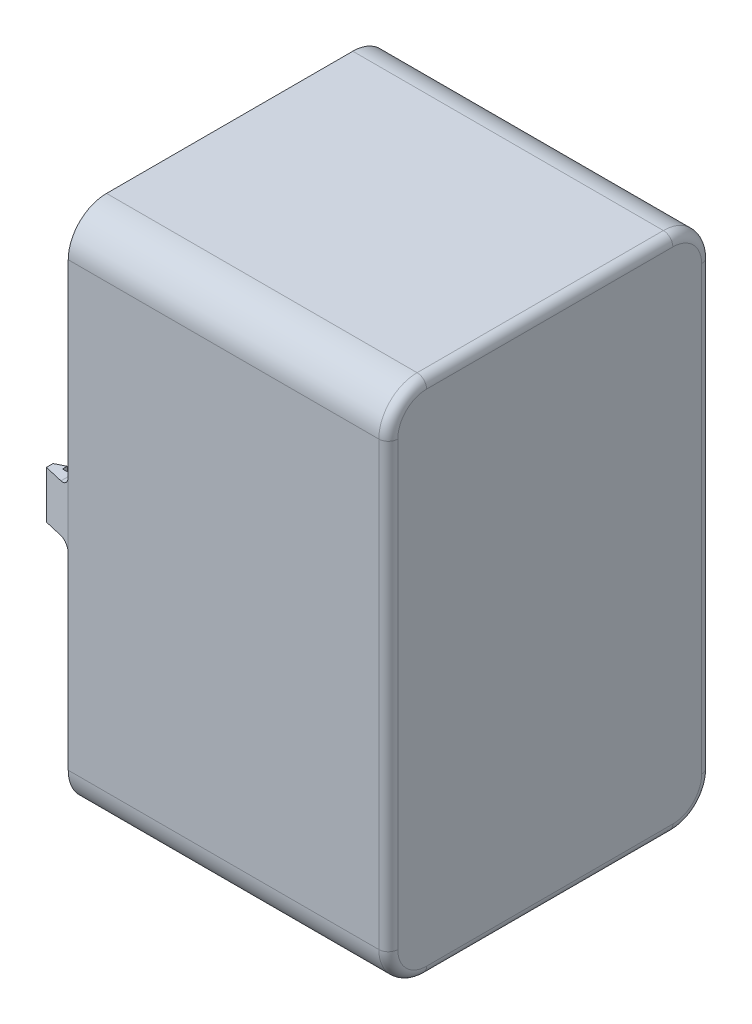
from build123d import *

# Parameters (mm, degrees)
BOSS_EXTRUDE2_DEPTH      = 13
BOSS_EXTRUDE2_DEPTH_BACK = 19.75
SKETCH2_W                = 39
SKETCH2_H                = 12
BOSS_EXTRUDE3_DEPTH      = 1
CUT_EXTRUDE1_DEPTH       = 19.727
CLIP_EDGE_DEPTH          = 2.5
FILLET1_R                = 1


with BuildPart() as part:
    # Sketch2 → Boss-Extrude2 (new, two sides: drawn at the far end of the back side and taken through both)
    with BuildSketch(Plane(origin=(0, 0, 0), x_dir=(0, -1, 0), z_dir=(1, 0, 0)).offset(-BOSS_EXTRUDE2_DEPTH_BACK)):
        with BuildLine():
            Line((-1027.172700071, 1376.290334899), (-1027.172700071, 1350.320334899))
            ThreePointArc((-1027.172700071, 1350.320334899), (-1025.989411467, 1347.463623503), (-1023.132700071, 1346.280334899))
            Line((-1023.132700071, 1346.280334899), (-976.512700071, 1346.280334899))
            ThreePointArc((-976.512700071, 1346.280334899), (-973.655988675, 1347.463623503), (-972.472700071, 1350.320334899))
            Line((-972.472700071, 1350.320334899), (-972.472700071, 1376.290334899))
            ThreePointArc((-972.472700071, 1376.290334899), (-973.655988675, 1379.147046295), (-976.512700071, 1380.330334899))
            Line((-976.512700071, 1380.330334899), (-1023.132700071, 1380.330334899))
            ThreePointArc((-1023.132700071, 1380.330334899), (-1025.989411467, 1379.147046295), (-1027.172700071, 1376.290334899))
        make_face()
        with Locations((-999.822700071, 1363.305334899)):
            Rectangle(SKETCH2_W, SKETCH2_H, mode=Mode.SUBTRACT)
    extrude(amount=BOSS_EXTRUDE2_DEPTH + BOSS_EXTRUDE2_DEPTH_BACK)

    # Sketch3 → Boss-Extrude3 (add)
    with BuildSketch(Plane.YZ.offset(13)):
        with BuildLine():
            Line((972.472700071, -1350.320334899), (972.472700071, -1376.290334899))
            ThreePointArc((972.472700071, -1376.290334899), (973.655988675, -1379.147046295), (976.512700071, -1380.330334899))
            Line((976.512700071, -1380.330334899), (1023.132700071, -1380.330334899))
            ThreePointArc((1023.132700071, -1380.330334899), (1025.989411467, -1379.147046295), (1027.172700071, -1376.290334899))
            Line((1027.172700071, -1376.290334899), (1027.172700071, -1350.320334899))
            ThreePointArc((1027.172700071, -1350.320334899), (1025.989411467, -1347.463623503), (1023.132700071, -1346.280334899))
            Line((1023.132700071, -1346.280334899), (976.512700071, -1346.280334899))
            ThreePointArc((976.512700071, -1346.280334899), (973.655988675, -1347.463623503), (972.472700071, -1350.320334899))
        make_face()
    extrude(amount=BOSS_EXTRUDE3_DEPTH)

    # Sketch6 → Cut-Extrude1 (cut)
    with BuildSketch(Plane(origin=(-19.75, 0, 0), x_dir=(0, -1, 0), z_dir=(-1, 0, 0))):
        with BuildLine():
            Line((-1025.772700071, -1350.320334899), (-1025.772700071, -1376.290334899))
            ThreePointArc((-1025.772700071, -1376.290334899), (-1024.999461974, -1378.157096801), (-1023.132700071, -1378.930334899))
            Line((-1023.132700071, -1378.930334899), (-976.512700071, -1378.930334899))
            ThreePointArc((-976.512700071, -1378.930334899), (-974.645938169, -1378.157096801), (-973.872700071, -1376.290334899))
            Line((-973.872700071, -1376.290334899), (-973.872700071, -1350.320334899))
            ThreePointArc((-973.872700071, -1350.320334899), (-974.645938169, -1348.453572996), (-976.512700071, -1347.680334899))
            Line((-976.512700071, -1347.680334899), (-1023.132700071, -1347.680334899))
            ThreePointArc((-1023.132700071, -1347.680334899), (-1024.999461974, -1348.453572996), (-1025.772700071, -1350.320334899))
        make_face()
    extrude(amount=-CUT_EXTRUDE1_DEPTH, mode=Mode.SUBTRACT)

    # Sketch10 → Clip Edge (add, symmetric)
    with BuildSketch(Plane(origin=(0, 999.822700071, 0), x_dir=(-1, 0, 0), z_dir=(0, -1, 0))):
        Polygon((19.75, 1346.280334899), (19.75, 1347.680334899), (21.75, 1347.680334899), (21.75, 1348.180334899), (22.75, 1347.680334899), (22.75, 1346.980334899), align=None)
    clip_edge = extrude(amount=CLIP_EDGE_DEPTH, both=True)

    # Mirror1: Clip Edge across plane
    add(clip_edge.mirror(Plane(origin=(0, 0, -1363.305334899), x_dir=(1, 0, 0), z_dir=(0, 0, -1))))

    # Fillet1
    # the kernel refuses this fillet: 1 mm, written as the material it adds along each edge
    with BuildSketch(Plane(origin=(-19.75, 1002.322700071, -1346.280334899), x_dir=(0, 1, 0), z_dir=(0, 0, -1))) as fillet1_piece_1_section:
        with BuildLine():
            CenterArc((FILLET1_R, -FILLET1_R), FILLET1_R, 90, 90)
            Line((0, -FILLET1_R), (0, 0))
            Line((0, 0), (FILLET1_R, 0))
        make_face()
    fillet1_piece_1 = extrude(amount=1.4, mode=Mode.PRIVATE)
    fillet1_piece_1 = split(fillet1_piece_1, bisect_by=Plane(origin=(-20.117660962, 1002.553814872, -1346.366122456), z_dir=(0.22722961560622243, 0, -0.973841209741839)), keep=Keep.TOP, mode=Mode.PRIVATE)
    add(fillet1_piece_1)
    with BuildSketch(Plane(origin=(-19.75, 997.322700071, -1346.280334899), x_dir=(0, -1, 0), z_dir=(0, 0, -1))) as fillet1_piece_2_section:
        with BuildLine():
            CenterArc((FILLET1_R, FILLET1_R), FILLET1_R, 180, 90)
            Line((0, FILLET1_R), (0, 0))
            Line((0, 0), (FILLET1_R, 0))
        make_face()
    fillet1_piece_2 = extrude(amount=1.4, mode=Mode.PRIVATE)
    fillet1_piece_2 = split(fillet1_piece_2, bisect_by=Plane(origin=(-20.117660962, 997.091585271, -1346.366122456), z_dir=(0.22722961560622243, 0, -0.973841209741839)), keep=Keep.TOP, mode=Mode.PRIVATE)
    add(fillet1_piece_2)
    with BuildSketch(Plane(origin=(-19.75, 997.322700071, -1380.330334899), x_dir=(0, -1, 0), z_dir=(0, 0, 1))) as fillet1_piece_3_section:
        with BuildLine():
            CenterArc((FILLET1_R, -FILLET1_R), FILLET1_R, 90, 90)
            Line((0, -FILLET1_R), (0, 0))
            Line((0, 0), (FILLET1_R, 0))
        make_face()
    fillet1_piece_3 = extrude(amount=1.4, mode=Mode.PRIVATE)
    fillet1_piece_3 = split(fillet1_piece_3, bisect_by=Plane(origin=(-20.117660962, 997.091585271, -1380.244547341), z_dir=(0.22722961560622243, 0, 0.973841209741839)), keep=Keep.TOP, mode=Mode.PRIVATE)
    add(fillet1_piece_3)
    with BuildSketch(Plane(origin=(-19.75, 1002.322700071, -1380.330334899), x_dir=(0, 1, 0), z_dir=(0, 0, 1))) as fillet1_piece_4_section:
        with BuildLine():
            CenterArc((FILLET1_R, FILLET1_R), FILLET1_R, 180, 90)
            Line((0, FILLET1_R), (0, 0))
            Line((0, 0), (FILLET1_R, 0))
        make_face()
    fillet1_piece_4 = extrude(amount=1.4, mode=Mode.PRIVATE)
    fillet1_piece_4 = split(fillet1_piece_4, bisect_by=Plane(origin=(-20.117660962, 1002.553814872, -1380.244547341), z_dir=(0.22722961560622243, 0, 0.973841209741839)), keep=Keep.TOP, mode=Mode.PRIVATE)
    add(fillet1_piece_4)
    with BuildSketch(Plane(origin=(13, 1021.822700071, -1369.305334899), x_dir=(-1, 0, 0), z_dir=(0, -1, 0)), Plane(origin=(13, 977.822700071, -1357.305334899), x_dir=(-1, 0, 0), z_dir=(0, 1, 0))) as fillet1_piece_5:
        with BuildLine():
            CenterArc((FILLET1_R, -FILLET1_R), FILLET1_R, 90, 90)
            Line((0, -FILLET1_R), (0, 0))
            Line((0, 0), (FILLET1_R, 0))
        make_face()
    extrude(amount=44)
    with BuildSketch(Plane(origin=(13, 1019.322700071, -1354.805334899), x_dir=(-1, 0, 0), z_dir=(0, 0, -1)), Plane(origin=(13, 980.322700071, -1371.805334899), x_dir=(-1, 0, 0), z_dir=(0, 0, 1))) as fillet1_piece_6:
        with BuildLine():
            CenterArc((FILLET1_R, -FILLET1_R), FILLET1_R, 90, 90)
            Line((0, -FILLET1_R), (0, 0))
            Line((0, 0), (FILLET1_R, 0))
        make_face()
    extrude(amount=17)
    # the kernel refuses this fillet: 1 mm, written as the material it takes off along each edge
    with BuildSketch(Plane(origin=(14, 976.512700071, -1350.320334899), x_dir=(0, 0, 1), z_dir=(0, 1, 0))) as fillet1_2_piece_1:
        with BuildLine():
            CenterArc((4.04 - FILLET1_R, -FILLET1_R), FILLET1_R, 0, 90)
            Line((4.04 - FILLET1_R, 0), (4.04, 0))
            Line((4.04, 0), (4.04, -FILLET1_R))
        make_face()
    revolve(axis=Axis((14, 976.512700071, -1350.320334899), (1, 0, 0)), revolution_arc=90, mode=Mode.SUBTRACT)
    with BuildSketch(Plane(origin=(14, 972.472700071, -1350.320334899), x_dir=(-1, 0, 0), z_dir=(0, 0, -1)), Plane(origin=(14, 1027.172700071, -1376.290334899), x_dir=(-1, 0, 0), z_dir=(0, 0, 1))) as fillet1_2_piece_2:
        with BuildLine():
            CenterArc((FILLET1_R, FILLET1_R), FILLET1_R, 180, 90)
            Line((0, FILLET1_R), (0, 0))
            Line((0, 0), (FILLET1_R, 0))
        make_face()
    extrude(amount=25.97, mode=Mode.SUBTRACT)
    with BuildSketch(Plane(origin=(14, 976.512700071, -1376.290334899), x_dir=(0, -1, 0), z_dir=(0, 0, 1))) as fillet1_2_piece_3:
        with BuildLine():
            CenterArc((4.04 - FILLET1_R, -FILLET1_R), FILLET1_R, 0, 90)
            Line((4.04 - FILLET1_R, 0), (4.04, 0))
            Line((4.04, 0), (4.04, -FILLET1_R))
        make_face()
    revolve(axis=Axis((14, 976.512700071, -1376.290334899), (1, 0, 0)), revolution_arc=90, mode=Mode.SUBTRACT)
    with BuildSketch(Plane(origin=(14, 976.512700071, -1380.330334899), x_dir=(-1, 0, 0), z_dir=(0, 1, 0)), Plane(origin=(14, 1023.132700071, -1346.280334899), x_dir=(-1, 0, 0), z_dir=(0, -1, 0))) as fillet1_2_piece_4:
        with BuildLine():
            CenterArc((FILLET1_R, FILLET1_R), FILLET1_R, 180, 90)
            Line((0, FILLET1_R), (0, 0))
            Line((0, 0), (FILLET1_R, 0))
        make_face()
    extrude(amount=46.62, mode=Mode.SUBTRACT)
    with BuildSketch(Plane(origin=(14, 1023.132700071, -1376.290334899), x_dir=(0, 0, -1), z_dir=(0, -1, 0))) as fillet1_2_piece_5:
        with BuildLine():
            CenterArc((4.04 - FILLET1_R, -FILLET1_R), FILLET1_R, 0, 90)
            Line((4.04, -FILLET1_R), (4.04, 0))
            Line((4.04, 0), (4.04 - FILLET1_R, 0))
        make_face()
    revolve(axis=Axis((14, 1023.132700071, -1376.290334899), (1, 0, 0)), revolution_arc=90, mode=Mode.SUBTRACT)
    with BuildSketch(Plane(origin=(14, 1023.132700071, -1350.320334899), x_dir=(0, 1, 0), z_dir=(0, 0, -1))) as fillet1_2_piece_6:
        with BuildLine():
            CenterArc((4.04 - FILLET1_R, -FILLET1_R), FILLET1_R, 0, 90)
            Line((4.04 - FILLET1_R, 0), (4.04, 0))
            Line((4.04, 0), (4.04, -FILLET1_R))
        make_face()
    revolve(axis=Axis((14, 1023.132700071, -1350.320334899), (1, 0, 0)), revolution_arc=90, mode=Mode.SUBTRACT)
    with BuildSketch(Plane(origin=(-0.023, 1019.322700071, -1369.305334899), x_dir=(0, 1, 0), z_dir=(0, 0, 1)), Plane(origin=(-0.023, 980.322700071, -1357.305334899), x_dir=(0, -1, 0), z_dir=(0, 0, -1))) as fillet1_2_piece_7:
        with BuildLine():
            CenterArc((FILLET1_R, -FILLET1_R), FILLET1_R, 90, 90)
            Line((0, -FILLET1_R), (0, 0))
            Line((0, 0), (FILLET1_R, 0))
        make_face()
    extrude(amount=12, mode=Mode.SUBTRACT)
    with BuildSketch(Plane(origin=(-0.023, 980.322700071, -1369.305334899), x_dir=(0, 0, -1), z_dir=(0, 1, 0)), Plane(origin=(-0.023, 1019.322700071, -1357.305334899), x_dir=(0, 0, 1), z_dir=(0, -1, 0))) as fillet1_2_piece_8:
        with BuildLine():
            CenterArc((FILLET1_R, -FILLET1_R), FILLET1_R, 90, 90)
            Line((0, -FILLET1_R), (0, 0))
            Line((0, 0), (FILLET1_R, 0))
        make_face()
    extrude(amount=39, mode=Mode.SUBTRACT)
    with BuildSketch(Plane(origin=(-0.023, 1019.322700071, -1371.805334899), x_dir=(0, 1, 0), z_dir=(0, 0, 1))) as fillet1_2_piece_9a_section:
        with BuildLine():
            CenterArc((FILLET1_R, -FILLET1_R), FILLET1_R, 90, 90)
            Line((0, -FILLET1_R), (0, 0))
            Line((0, 0), (FILLET1_R, 0))
        make_face()
    fillet1_2_piece_9a = extrude(amount=14.5, mode=Mode.PRIVATE)
    fillet1_2_piece_9a = split(fillet1_2_piece_9a, bisect_by=Plane(origin=(0.203395114, 1019.549095185, -1369.305334899), z_dir=(0, 0, -1)), keep=Keep.TOP, mode=Mode.PRIVATE)
    with BuildSketch(Plane(origin=(-0.023, 980.322700071, -1369.305334899), x_dir=(0, 0, -1), z_dir=(0, 1, 0))) as fillet1_2_piece_9b_section:
        with BuildLine():
            CenterArc((FILLET1_R, -FILLET1_R), FILLET1_R, 90, 90)
            Line((0, -FILLET1_R), (0, 0))
            Line((0, 0), (FILLET1_R, 0))
        make_face()
    fillet1_2_piece_9b = extrude(amount=41.5, mode=Mode.PRIVATE)
    fillet1_2_piece_9b = split(fillet1_2_piece_9b, bisect_by=Plane(origin=(0.203395114, 1019.322700071, -1369.531730013), z_dir=(0, 1, 0)), keep=Keep.TOP, mode=Mode.PRIVATE)
    fillet1_2_piece_9 = fillet1_2_piece_9a & fillet1_2_piece_9b
    add(fillet1_2_piece_9, mode=Mode.SUBTRACT)
    with BuildSketch(Plane(origin=(-0.023, 1021.822700071, -1357.305334899), x_dir=(0, 0, 1), z_dir=(0, -1, 0))) as fillet1_2_piece_10a_section:
        with BuildLine():
            CenterArc((FILLET1_R, -FILLET1_R), FILLET1_R, 90, 90)
            Line((0, -FILLET1_R), (0, 0))
            Line((0, 0), (FILLET1_R, 0))
        make_face()
    fillet1_2_piece_10a = extrude(amount=41.5, mode=Mode.PRIVATE)
    fillet1_2_piece_10a = split(fillet1_2_piece_10a, bisect_by=Plane(origin=(0.203395114, 1019.322700071, -1357.078939784), z_dir=(0, 1, 0)), keep=Keep.TOP, mode=Mode.PRIVATE)
    with BuildSketch(Plane(origin=(-0.023, 1019.322700071, -1369.305334899), x_dir=(0, 1, 0), z_dir=(0, 0, 1))) as fillet1_2_piece_10b_section:
        with BuildLine():
            CenterArc((FILLET1_R, -FILLET1_R), FILLET1_R, 90, 90)
            Line((0, -FILLET1_R), (0, 0))
            Line((0, 0), (FILLET1_R, 0))
        make_face()
    fillet1_2_piece_10b = extrude(amount=14.5, mode=Mode.PRIVATE)
    fillet1_2_piece_10b = split(fillet1_2_piece_10b, bisect_by=Plane(origin=(0.203395114, 1019.549095185, -1357.305334899), z_dir=(0, 0, 1)), keep=Keep.TOP, mode=Mode.PRIVATE)
    fillet1_2_piece_10 = fillet1_2_piece_10a & fillet1_2_piece_10b
    add(fillet1_2_piece_10, mode=Mode.SUBTRACT)
    with BuildSketch(Plane(origin=(-0.023, 980.322700071, -1357.305334899), x_dir=(0, -1, 0), z_dir=(0, 0, -1))) as fillet1_2_piece_11a_section:
        with BuildLine():
            CenterArc((FILLET1_R, -FILLET1_R), FILLET1_R, 90, 90)
            Line((0, -FILLET1_R), (0, 0))
            Line((0, 0), (FILLET1_R, 0))
        make_face()
    fillet1_2_piece_11a = extrude(amount=14.5, mode=Mode.PRIVATE)
    fillet1_2_piece_11a = split(fillet1_2_piece_11a, bisect_by=Plane(origin=(0.203395114, 980.096304957, -1369.305334899), z_dir=(0, 0, -1)), keep=Keep.TOP, mode=Mode.PRIVATE)
    with BuildSketch(Plane(origin=(-0.023, 977.822700071, -1369.305334899), x_dir=(0, 0, -1), z_dir=(0, 1, 0))) as fillet1_2_piece_11b_section:
        with BuildLine():
            CenterArc((FILLET1_R, -FILLET1_R), FILLET1_R, 90, 90)
            Line((0, -FILLET1_R), (0, 0))
            Line((0, 0), (FILLET1_R, 0))
        make_face()
    fillet1_2_piece_11b = extrude(amount=41.5, mode=Mode.PRIVATE)
    fillet1_2_piece_11b = split(fillet1_2_piece_11b, bisect_by=Plane(origin=(0.203395114, 980.322700071, -1369.531730013), z_dir=(0, -1, 0)), keep=Keep.TOP, mode=Mode.PRIVATE)
    fillet1_2_piece_11 = fillet1_2_piece_11a & fillet1_2_piece_11b
    add(fillet1_2_piece_11, mode=Mode.SUBTRACT)
    with BuildSketch(Plane(origin=(-0.023, 980.322700071, -1354.805334899), x_dir=(0, -1, 0), z_dir=(0, 0, -1))) as fillet1_2_piece_12a_section:
        with BuildLine():
            CenterArc((FILLET1_R, -FILLET1_R), FILLET1_R, 90, 90)
            Line((0, -FILLET1_R), (0, 0))
            Line((0, 0), (FILLET1_R, 0))
        make_face()
    fillet1_2_piece_12a = extrude(amount=14.5, mode=Mode.PRIVATE)
    fillet1_2_piece_12a = split(fillet1_2_piece_12a, bisect_by=Plane(origin=(0.203395114, 980.096304957, -1357.305334899), z_dir=(0, 0, 1)), keep=Keep.TOP, mode=Mode.PRIVATE)
    with BuildSketch(Plane(origin=(-0.023, 1019.322700071, -1357.305334899), x_dir=(0, 0, 1), z_dir=(0, -1, 0))) as fillet1_2_piece_12b_section:
        with BuildLine():
            CenterArc((FILLET1_R, -FILLET1_R), FILLET1_R, 90, 90)
            Line((0, -FILLET1_R), (0, 0))
            Line((0, 0), (FILLET1_R, 0))
        make_face()
    fillet1_2_piece_12b = extrude(amount=41.5, mode=Mode.PRIVATE)
    fillet1_2_piece_12b = split(fillet1_2_piece_12b, bisect_by=Plane(origin=(0.203395114, 980.322700071, -1357.078939784), z_dir=(0, -1, 0)), keep=Keep.TOP, mode=Mode.PRIVATE)
    fillet1_2_piece_12 = fillet1_2_piece_12a & fillet1_2_piece_12b
    add(fillet1_2_piece_12, mode=Mode.SUBTRACT)


solid = part.part
